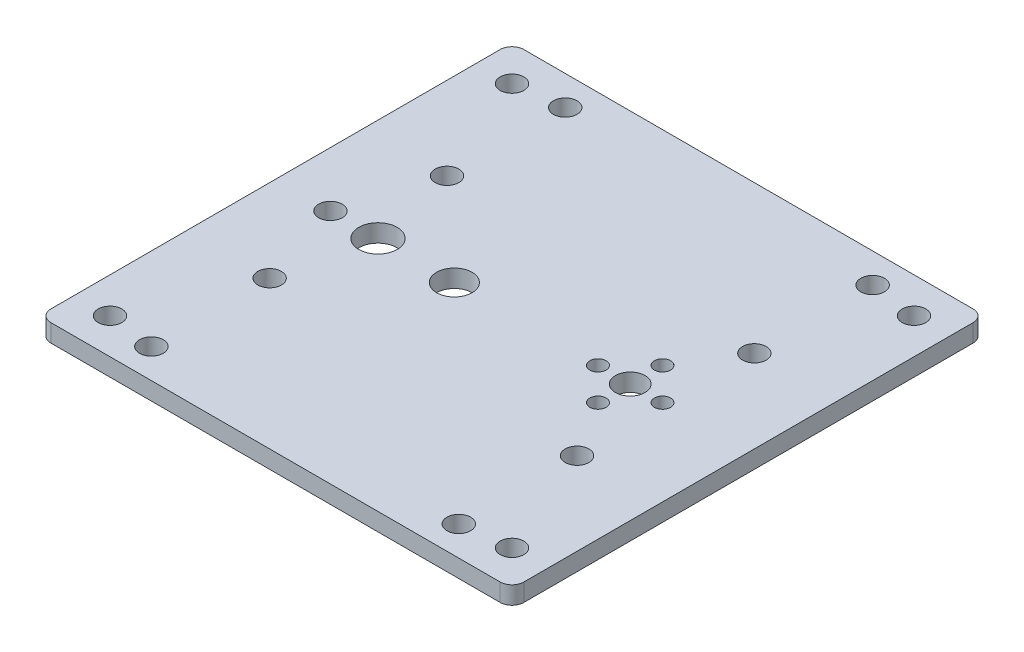
from build123d import *

# Parameters (mm, degrees)
SKETCH1_W           = 80
SKETCH1_H           = 80
BOSS_EXTRUDE1_DEPTH = 3
SKETCH2_R           = 2
SKETCH2_R_2         = 3.25
CUT_EXTRUDE1_DEPTH  = 114.176852757
SKETCH3_R           = 2.5
CUT_EXTRUDE2_DEPTH  = 114.176852757
SKETCH4_R           = 1.375
CUT_EXTRUDE3_DEPTH  = 114.176852757
SKETCH5_R           = 3
CUT_EXTRUDE4_DEPTH  = 114.176852757
SKETCH6_R           = 2
CUT_EXTRUDE5_DEPTH  = 114.176852757
FILLET1_R           = 2
SKETCH7_R           = 2
CUT_EXTRUDE6_DEPTH  = 114.176852757


with BuildPart() as part:
    # Sketch1 → Boss-Extrude1 (new body)
    with BuildSketch(Plane(origin=(0, 0, 0), x_dir=(1, 0, 0), z_dir=(0, 1, 0))):
        with Locations((40, 40)):
            Rectangle(SKETCH1_W, SKETCH1_H)
    extrude(amount=BOSS_EXTRUDE1_DEPTH)

    # Sketch2 → Cut-Extrude1 (cut, through all)
    with BuildSketch(Plane(origin=(0, 3, 0), x_dir=(1, 0, 0), z_dir=(0, 1, 0))):
        with Locations((9.29, 40)):
            Circle(SKETCH2_R)
        with Locations((17.33, 40)):
            Circle(SKETCH2_R_2)
    extrude(amount=-CUT_EXTRUDE1_DEPTH, mode=Mode.SUBTRACT)

    # Sketch3 → Cut-Extrude2 (cut, through all)
    with BuildSketch(Plane(origin=(0, 3, 0), x_dir=(1, 0, 0), z_dir=(0, 1, 0))):
        with Locations((60, 40)):
            Circle(SKETCH3_R)
    extrude(amount=-CUT_EXTRUDE2_DEPTH, mode=Mode.SUBTRACT)

    # Sketch4 → Cut-Extrude3 (cut, through all)
    with BuildSketch(Plane(origin=(0, 3, 0), x_dir=(1, 0, 0), z_dir=(0, 1, 0))):
        with Locations((65.46, 40)):
            Circle(SKETCH4_R)
        with Locations((54.54, 40)):
            Circle(SKETCH4_R)
        with Locations((60, 34.54)):
            Circle(SKETCH4_R)
        with Locations((60, 45.46)):
            Circle(SKETCH4_R)
    extrude(amount=-CUT_EXTRUDE3_DEPTH, mode=Mode.SUBTRACT)

    # Sketch5 → Cut-Extrude4 (cut, through all)
    with BuildSketch(Plane(origin=(0, 3, 0), x_dir=(1, 0, 0), z_dir=(0, 1, 0))):
        with Locations((30.25, 40)):
            Circle(SKETCH5_R)
    extrude(amount=-CUT_EXTRUDE4_DEPTH, mode=Mode.SUBTRACT)

    # Sketch6 → Cut-Extrude5 (cut, through all)
    with BuildSketch(Plane(origin=(0, 3, 0), x_dir=(1, 0, 0), z_dir=(0, 1, 0))):
        with Locations((6, 74)):
            Circle(SKETCH6_R)
        with Locations((74, 74)):
            Circle(SKETCH6_R)
        with Locations((74, 6)):
            Circle(SKETCH6_R)
        with Locations((6, 6)):
            Circle(SKETCH6_R)
    extrude(amount=-CUT_EXTRUDE5_DEPTH, mode=Mode.SUBTRACT)

    # Fillet1
    fillet1_edges = [part.edges().sort_by_distance(p)[0] for p in [
        (0, 1.5, -80),
        (80, 1.5, -80),
        (0, 1.5, 0),
        (80, 1.5, 0),
    ]]
    fillet(fillet1_edges, radius=FILLET1_R)

    # Sketch7 → Cut-Extrude6 (cut, through all)
    with BuildSketch(Plane(origin=(0, 3, 0), x_dir=(1, 0, 0), z_dir=(0, 1, 0))):
        with Locations((14, 5)):
            Circle(SKETCH7_R)
        with Locations((66, 5)):
            Circle(SKETCH7_R)
        with Locations((66, 25)):
            Circle(SKETCH7_R)
        with Locations((14, 25)):
            Circle(SKETCH7_R)
        with Locations((14, 75)):
            Circle(SKETCH7_R)
        with Locations((14, 55)):
            Circle(SKETCH7_R)
        with Locations((66, 75)):
            Circle(SKETCH7_R)
        with Locations((66, 55)):
            Circle(SKETCH7_R)
    extrude(amount=-CUT_EXTRUDE6_DEPTH, mode=Mode.SUBTRACT)


solid = part.part
